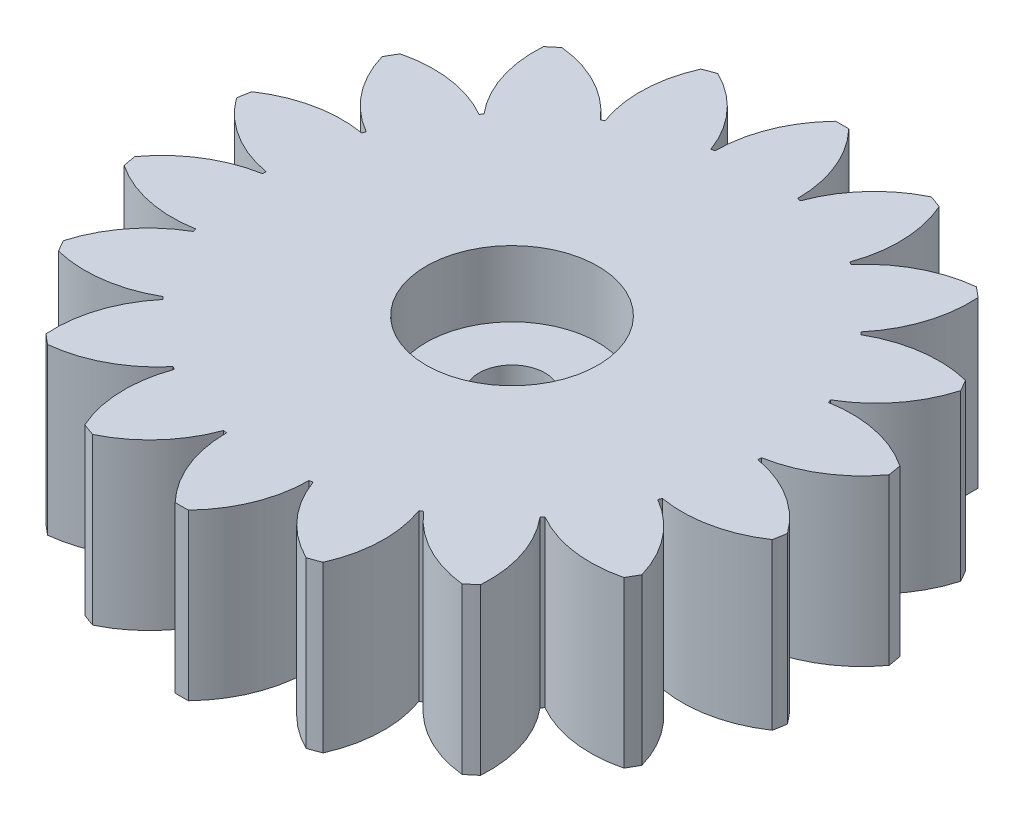
from build123d import *

# Parameters (mm, degrees)
SKETCH1_R           = 7.5
BOSS_EXTRUDE1_DEPTH = 5
SKETCH2_R           = 1
CUT_EXTRUDE1_DEPTH  = 10
SKETCH3_R           = 2.6
CUT_EXTRUDE2_DEPTH  = 2
BOSS_EXTRUDE3_DEPTH = 5
CIRPATTERN1_DEPTH   = 5


# Read off the part's stored shape, not the designer's step: CirPattern1
with BuildPart() as part:
    # Sketch1 → Boss-Extrude1 (new body)
    with BuildSketch(Plane(origin=(0, 0, 0), x_dir=(1, 0, 0), z_dir=(0, 1, 0))):
        with Locations(Location((0, 0, 0), (0, 0, 270))):
            Circle(SKETCH1_R)
    extrude(amount=BOSS_EXTRUDE1_DEPTH)

    # Sketch2 → Cut-Extrude1 (cut)
    with BuildSketch(Plane(origin=(0, 5, 0), x_dir=(1, 0, 0), z_dir=(0, 1, 0))):
        with Locations(Location((0, 0, 0), (0, 0, 270))):
            Circle(SKETCH2_R)
    extrude(amount=-CUT_EXTRUDE1_DEPTH, mode=Mode.SUBTRACT)

    # Sketch3 → Cut-Extrude2 (cut)
    with BuildSketch(Plane(origin=(0, 5, 0), x_dir=(1, 0, 0), z_dir=(0, 1, 0))):
        with Locations(Location((0, 0, 0), (0, 0, 270))):
            Circle(SKETCH3_R)
    extrude(amount=-CUT_EXTRUDE2_DEPTH, mode=Mode.SUBTRACT)

    # Sketch6 → Boss-Extrude3 (add)
    with BuildSketch(Plane(origin=(0, 0, 0), x_dir=(1, 0, 0), z_dir=(0, 1, 0))):
        with BuildLine():
            ThreePointArc((0.2, 9.9979998), (0, 10), (-0.2, 9.9979998))
            ThreePointArc((-0.2, 9.9979998), (-0.977699989, 8.79848798), (-1.25, 7.395099729))
            ThreePointArc((-1.25, 7.395099729), (0, 7.5), (1.25, 7.395099729))
            ThreePointArc((1.25, 7.395099729), (0.977699989, 8.79848798), (0.2, 9.9979998))
        make_face()
    extrude(amount=BOSS_EXTRUDE3_DEPTH)

    # CirPattern1 outline → CirPattern1 (add)
    with BuildSketch(Plane(origin=(0, 0, 0), x_dir=(1, 0, 0), z_dir=(0, 1, 0))):
        with BuildLine():
            ThreePointArc((-3.607455849, 9.326642606), (-3.927997585, 7.933481138), (-3.703888845, 6.521595466))
            ThreePointArc((-3.703888845, 6.521595466), (-2.565151075, 7.047694656), (-1.354657293, 7.376645825))
            ThreePointArc((-1.354657293, 7.376645825), (-2.090522655, 8.602267319), (-3.2315788, 9.463450663))
            ThreePointArc((-3.2315788, 9.463450663), (-3.420201433, 9.396926208), (-3.607455849, 9.326642606))
        make_face()
        with BuildLine():
            ThreePointArc((-6.579799282, 7.530354667), (-6.404520701, 6.111579386), (-5.711034032, 4.861490542))
            ThreePointArc((-5.711034032, 4.861490542), (-4.820907072, 5.745333324), (-3.795922924, 6.468459566))
            ThreePointArc((-3.795922924, 6.468459566), (-4.906597414, 7.368486264), (-6.273381504, 7.787469711))
            ThreePointArc((-6.273381504, 7.787469711), (-6.427876097, 7.660444431), (-6.579799282, 7.530354667))
        make_face()
        with BuildLine():
            ThreePointArc((-8.758521814, 4.825794819), (-8.1085641, 3.552530962), (-7.029344229, 2.61501811))
            ThreePointArc((-7.029344229, 2.61501811), (-6.495190528, 3.75), (-5.779344229, 4.780081619))
            ThreePointArc((-5.779344229, 4.780081619), (-7.130864111, 5.245957017), (-8.558521814, 5.172204981))
            ThreePointArc((-8.558521814, 5.172204981), (-8.660254038, 5), (-8.758521814, 4.825794819))
        make_face()
        with BuildLine():
            ThreePointArc((-9.880837353, 1.539172895), (-8.834594998, 0.564994875), (-7.499811769, 0.0531359))
            ThreePointArc((-7.499811769, 0.0531359), (-7.386058148, 1.302361332), (-7.065691325, 2.515155283))
            ThreePointArc((-7.065691325, 2.515155283), (-8.495043356, 2.490687933), (-9.811378082, 1.933095996))
            ThreePointArc((-9.811378082, 1.933095996), (-9.84807753, 1.736481777), (-9.880837353, 1.539172895))
        make_face()
        with BuildLine():
            ThreePointArc((-9.811378082, -1.933095996), (-8.495043356, -2.490687933), (-7.065691325, -2.515155283))
            ThreePointArc((-7.065691325, -2.515155283), (-7.386058148, -1.302361332), (-7.499811769, -0.0531359))
            ThreePointArc((-7.499811769, -0.0531359), (-8.834594998, -0.564994875), (-9.880837353, -1.539172895))
            ThreePointArc((-9.880837353, -1.539172895), (-9.84807753, -1.736481777), (-9.811378082, -1.933095996))
        make_face()
        with BuildLine():
            ThreePointArc((-8.558521814, -5.172204981), (-7.130864111, -5.245957017), (-5.779344229, -4.780081619))
            ThreePointArc((-5.779344229, -4.780081619), (-6.495190528, -3.75), (-7.029344229, -2.61501811))
            ThreePointArc((-7.029344229, -2.61501811), (-8.1085641, -3.552530962), (-8.758521814, -4.825794819))
            ThreePointArc((-8.758521814, -4.825794819), (-8.660254038, -5), (-8.558521814, -5.172204981))
        make_face()
        with BuildLine():
            ThreePointArc((-6.273381504, -7.787469711), (-4.906597414, -7.368486264), (-3.795922924, -6.468459566))
            ThreePointArc((-3.795922924, -6.468459566), (-4.820907072, -5.745333324), (-5.711034032, -4.861490542))
            ThreePointArc((-5.711034032, -4.861490542), (-6.404520701, -6.111579386), (-6.579799282, -7.530354667))
            ThreePointArc((-6.579799282, -7.530354667), (-6.427876097, -7.660444431), (-6.273381504, -7.787469711))
        make_face()
        with BuildLine():
            ThreePointArc((-3.2315788, -9.463450663), (-2.090522655, -8.602267319), (-1.354657293, -7.376645824))
            ThreePointArc((-1.354657293, -7.376645824), (-2.565151075, -7.047694656), (-3.703888845, -6.521595466))
            ThreePointArc((-3.703888845, -6.521595466), (-3.927997585, -7.933481138), (-3.607455849, -9.326642606))
            ThreePointArc((-3.607455849, -9.326642606), (-3.420201433, -9.396926208), (-3.2315788, -9.463450663))
        make_face()
        with BuildLine():
            ThreePointArc((0.2, -9.9979998), (0.977699989, -8.79848798), (1.25, -7.395099729))
            ThreePointArc((1.25, -7.395099729), (0, -7.5), (-1.25, -7.395099729))
            ThreePointArc((-1.25, -7.395099729), (-0.977699989, -8.79848798), (-0.2, -9.9979998))
            ThreePointArc((-0.2, -9.9979998), (0, -10), (0.2, -9.9979998))
        make_face()
        with BuildLine():
            ThreePointArc((3.607455849, -9.326642606), (3.927997585, -7.933481138), (3.703888845, -6.521595466))
            ThreePointArc((3.703888845, -6.521595466), (2.565151075, -7.047694656), (1.354657293, -7.376645824))
            ThreePointArc((1.354657293, -7.376645824), (2.090522655, -8.602267319), (3.2315788, -9.463450663))
            ThreePointArc((3.2315788, -9.463450663), (3.420201433, -9.396926208), (3.607455849, -9.326642606))
        make_face()
        with BuildLine():
            ThreePointArc((6.579799282, -7.530354667), (6.404520701, -6.111579386), (5.711034032, -4.861490542))
            ThreePointArc((5.711034032, -4.861490542), (4.820907072, -5.745333324), (3.795922924, -6.468459566))
            ThreePointArc((3.795922924, -6.468459566), (4.906597414, -7.368486264), (6.273381504, -7.787469711))
            ThreePointArc((6.273381504, -7.787469711), (6.427876097, -7.660444431), (6.579799282, -7.530354667))
        make_face()
        with BuildLine():
            ThreePointArc((8.758521814, -4.825794819), (8.1085641, -3.552530962), (7.029344229, -2.61501811))
            ThreePointArc((7.029344229, -2.61501811), (6.495190528, -3.75), (5.779344229, -4.780081619))
            ThreePointArc((5.779344229, -4.780081619), (7.130864111, -5.245957017), (8.558521814, -5.172204981))
            ThreePointArc((8.558521814, -5.172204981), (8.660254038, -5), (8.758521814, -4.825794819))
        make_face()
        with BuildLine():
            ThreePointArc((1.354657293, 7.376645825), (2.565151075, 7.047694656), (3.703888845, 6.521595466))
            ThreePointArc((3.703888845, 6.521595466), (3.927997585, 7.933481138), (3.607455849, 9.326642606))
            ThreePointArc((3.607455849, 9.326642606), (3.420201433, 9.396926208), (3.2315788, 9.463450663))
            ThreePointArc((3.2315788, 9.463450663), (2.090522655, 8.602267319), (1.354657293, 7.376645825))
        make_face()
        with BuildLine():
            ThreePointArc((3.795922924, 6.468459566), (4.820907072, 5.745333324), (5.711034032, 4.861490542))
            ThreePointArc((5.711034032, 4.861490542), (6.404520701, 6.111579386), (6.579799282, 7.530354667))
            ThreePointArc((6.579799282, 7.530354667), (6.427876097, 7.660444431), (6.273381504, 7.787469711))
            ThreePointArc((6.273381504, 7.787469711), (4.906597414, 7.368486264), (3.795922924, 6.468459566))
        make_face()
        with BuildLine():
            ThreePointArc((5.779344229, 4.780081619), (6.495190528, 3.75), (7.029344229, 2.61501811))
            ThreePointArc((7.029344229, 2.61501811), (8.1085641, 3.552530962), (8.758521814, 4.825794819))
            ThreePointArc((8.758521814, 4.825794819), (8.660254038, 5), (8.558521814, 5.172204981))
            ThreePointArc((8.558521814, 5.172204981), (7.130864111, 5.245957017), (5.779344229, 4.780081619))
        make_face()
        with BuildLine():
            ThreePointArc((7.065691325, 2.515155283), (7.386058148, 1.302361332), (7.499811769, 0.0531359))
            ThreePointArc((7.499811769, 0.0531359), (8.834594998, 0.564994875), (9.880837353, 1.539172895))
            ThreePointArc((9.880837353, 1.539172895), (9.84807753, 1.736481777), (9.811378082, 1.933095996))
            ThreePointArc((9.811378082, 1.933095996), (8.495043356, 2.490687933), (7.065691325, 2.515155283))
        make_face()
        with BuildLine():
            ThreePointArc((9.811378082, -1.933095996), (9.84807753, -1.736481777), (9.880837353, -1.539172895))
            ThreePointArc((9.880837353, -1.539172895), (8.834594998, -0.564994875), (7.499811769, -0.0531359))
            ThreePointArc((7.499811769, -0.0531359), (7.386058148, -1.302361332), (7.065691325, -2.515155283))
            ThreePointArc((7.065691325, -2.515155283), (8.495043356, -2.490687933), (9.811378082, -1.933095996))
        make_face()
    extrude(amount=CIRPATTERN1_DEPTH)


solid = part.part
